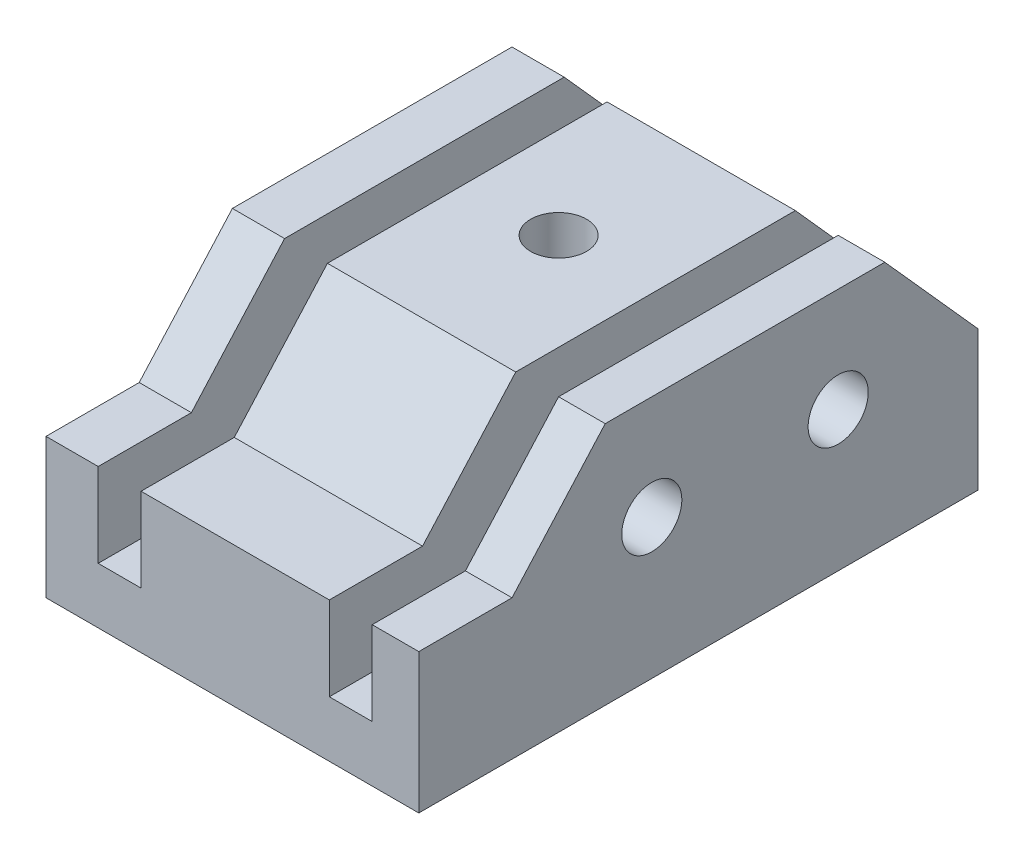
from build123d import *

# Parameters (mm, degrees)
SKETCH1_W           = 63.5
SKETCH1_H           = 6.35
BOSS_EXTRUDE1_DEPTH = 50.8
BOSS_EXTRUDE2_DEPTH = 50.8
SKETCH10_W          = 5.842
SKETCH10_H          = 25.629031657
CUT_EXTRUDE1_DEPTH  = 88.854357354
LPATTERN3_COUNT     = 2
LPATTERN3_PITCH     = 31.496
SKETCH11_R          = 4.09575
CUT_EXTRUDE2_DEPTH  = 88.854357354
BOSS_EXTRUDE3_DEPTH = 12.7
SKETCH23_R          = 3.81
CUT_EXTRUDE6_DEPTH  = 88.854357354
SKETCH24_W          = 22.86
SKETCH24_H          = 58.42
CUT_EXTRUDE7_DEPTH  = 4.58
SKETCH25_R          = 7
CUT_EXTRUDE8_DEPTH  = 2.799999956
SKETCH26_R          = 3
CUT_EXTRUDE9_DEPTH  = 10


with BuildPart() as part:
    # Sketch1 → Boss-Extrude1 (new body)
    with BuildSketch(Plane(origin=(0, 0, 0), x_dir=(0, 0, -1), z_dir=(1, 0, 0))):
        with Locations((31.75, 3.175)):
            Rectangle(SKETCH1_W, SKETCH1_H)
    extrude(amount=-BOSS_EXTRUDE1_DEPTH)

    # Sketch2 → Boss-Extrude2 (add)
    with BuildSketch(Plane(origin=(0, 0, 0), x_dir=(0, 0, -1), z_dir=(1, 0, 0))):
        Polygon((0, 6.35), (0, 19.05), (12.7, 33.249031657), (50.8, 33.249031657), (63.5, 19.05), (63.5, 6.35), align=None)
    extrude(amount=-BOSS_EXTRUDE2_DEPTH)

    # Sketch10 → Cut-Extrude1 (cut, through all)
    with BuildSketch(Plane(origin=(0, 0, -63.5), x_dir=(-1, 0, 0), z_dir=(0, 0, -1))):
        with Locations((9.271, 20.434515829)):
            Rectangle(SKETCH10_W, SKETCH10_H)
    cut_extrude1 = extrude(amount=-CUT_EXTRUDE1_DEPTH, mode=Mode.SUBTRACT)

    # LPattern3: Cut-Extrude1 ×2
    with Locations(*[(-i * LPATTERN3_PITCH, 0, 0) for i in range(1, LPATTERN3_COUNT)]):
        add(cut_extrude1, mode=Mode.SUBTRACT)

    # Sketch11 → Cut-Extrude2 (cut, through all)
    with BuildSketch(Plane(origin=(0, 0, 0), x_dir=(0, 0, -1), z_dir=(1, 0, 0))):
        with Locations((19.05, 19.05)):
            Circle(SKETCH11_R)
        with Locations((44.45, 19.05)):
            Circle(SKETCH11_R)
    extrude(amount=-CUT_EXTRUDE2_DEPTH, mode=Mode.SUBTRACT)

    # Sketch22 → Boss-Extrude3 (add)
    with BuildSketch(Plane.XY):
        Polygon((0, 0), (-50.8, 0), (-50.8, 7.62), (-50.8, 19.05), (-43.688, 19.05), (-43.688, 7.62), (-37.846, 7.62), (-37.846, 19.05), (-12.192, 19.05), (-12.192, 7.62), (-6.35, 7.62), (-6.35, 19.05), (0, 19.05), (0, 7.62), align=None)
    extrude(amount=BOSS_EXTRUDE3_DEPTH)

    # Sketch23 → Cut-Extrude6 (cut, through all)
    with BuildSketch(Plane(origin=(0, 33.249031657, 0), x_dir=(1, 0, 0), z_dir=(0, 1, 0))):
        with Locations((-25.4, 31.75)):
            Circle(SKETCH23_R)
    extrude(amount=-CUT_EXTRUDE6_DEPTH, mode=Mode.SUBTRACT)

    # Sketch24 → Cut-Extrude7 (cut)
    with BuildSketch(Plane.XZ):
        with Locations((-25.4, -21.59)):
            Rectangle(SKETCH24_W, SKETCH24_H)
    extrude(amount=-CUT_EXTRUDE7_DEPTH, mode=Mode.SUBTRACT)

    # Sketch25 → Cut-Extrude8 (cut)
    with BuildSketch(Plane.XZ.offset(-4.58)):
        with Locations((-25.4, -31.75)):
            Circle(SKETCH25_R)
    extrude(amount=-CUT_EXTRUDE8_DEPTH, mode=Mode.SUBTRACT)

    # Sketch26 → Cut-Extrude9 (cut)
    with BuildSketch(Plane(origin=(0, 4.58, 0), x_dir=(-1, 0, 0), z_dir=(0, -1, 0))):
        with Locations((30.4, 46.15)):
            Circle(SKETCH26_R)
        with Locations((20.4, 46.15)):
            Circle(SKETCH26_R)
        with Locations((20.4, -1.89703266)):
            Circle(SKETCH26_R)
        with Locations((30.4, -1.89703266)):
            Circle(SKETCH26_R)
    extrude(amount=-CUT_EXTRUDE9_DEPTH, mode=Mode.SUBTRACT)


solid = part.part
